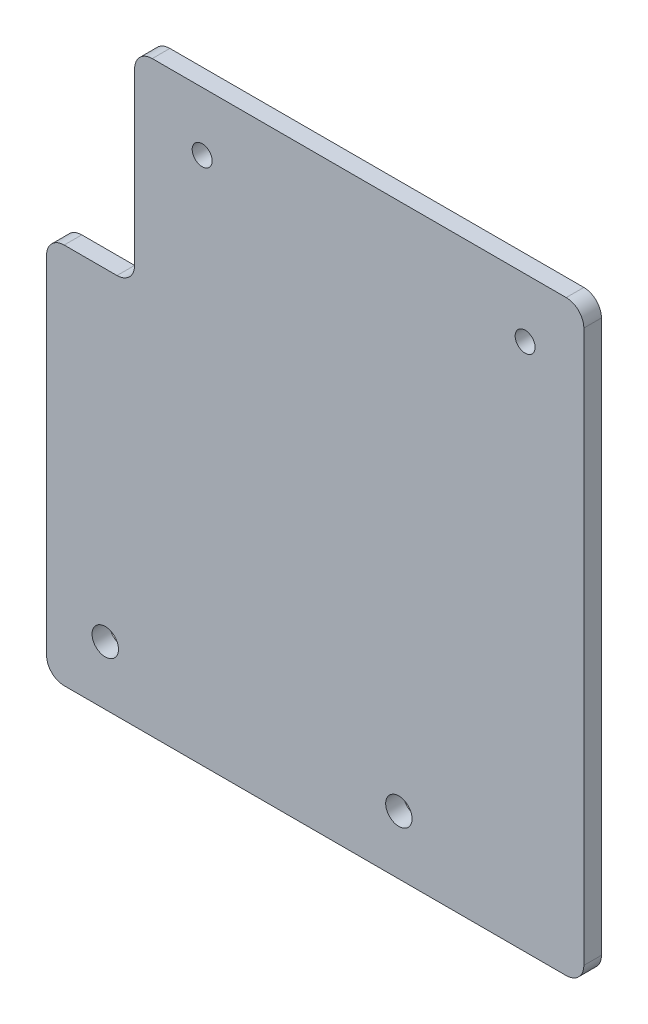
from build123d import *

# Parameters (mm, degrees)
SKETCH1_W            = 91.5
SKETCH1_H            = 100
BOSS_EXTRUDE1_DEPTH  = 3
M4_CLEARANCE_HOLE1_D = 4.5
M3_CLEARANCE_HOLE1_D = 3.4
SKETCH6_W            = 15
SKETCH6_H            = 35
CUT_EXTRUDE1_DEPTH   = 107.30733747
FILLET1_R            = 3


with BuildPart() as part:
    # Sketch1 → Boss-Extrude1 (new body)
    with BuildSketch(Plane.XY):
        with Locations((10.75, 40)):
            Rectangle(SKETCH1_W, SKETCH1_H)
    extrude(amount=BOSS_EXTRUDE1_DEPTH)

    # M4 Clearance Hole1 (through all)
    with Locations(Plane.XY.offset(3)):
        with Locations((-25, 0), (25, 0)):
            Hole(M4_CLEARANCE_HOLE1_D / 2)

    # M3 Clearance Hole1 (through all)
    with Locations(Plane.XY.offset(3)):
        with Locations((-8.5, 80), (46.5, 80)):
            Hole(M3_CLEARANCE_HOLE1_D / 2)

    # Sketch6 → Cut-Extrude1 (cut, through all)
    with BuildSketch(Plane.XY.offset(3)):
        with Locations((-27.5, 72.5)):
            Rectangle(SKETCH6_W, SKETCH6_H)
    extrude(amount=-CUT_EXTRUDE1_DEPTH, mode=Mode.SUBTRACT)

    # Fillet1
    fillet1_edges = [part.edges().sort_by_distance(p)[0] for p in [
        (56.5, 90, 1.5),
        (56.5, -10, 1.5),
        (-35, -10, 1.5),
        (-20, 90, 1.5),
        (-20, 55, 1.5),
        (-35, 55, 1.5),
    ]]
    fillet(fillet1_edges, radius=FILLET1_R)


solid = part.part
